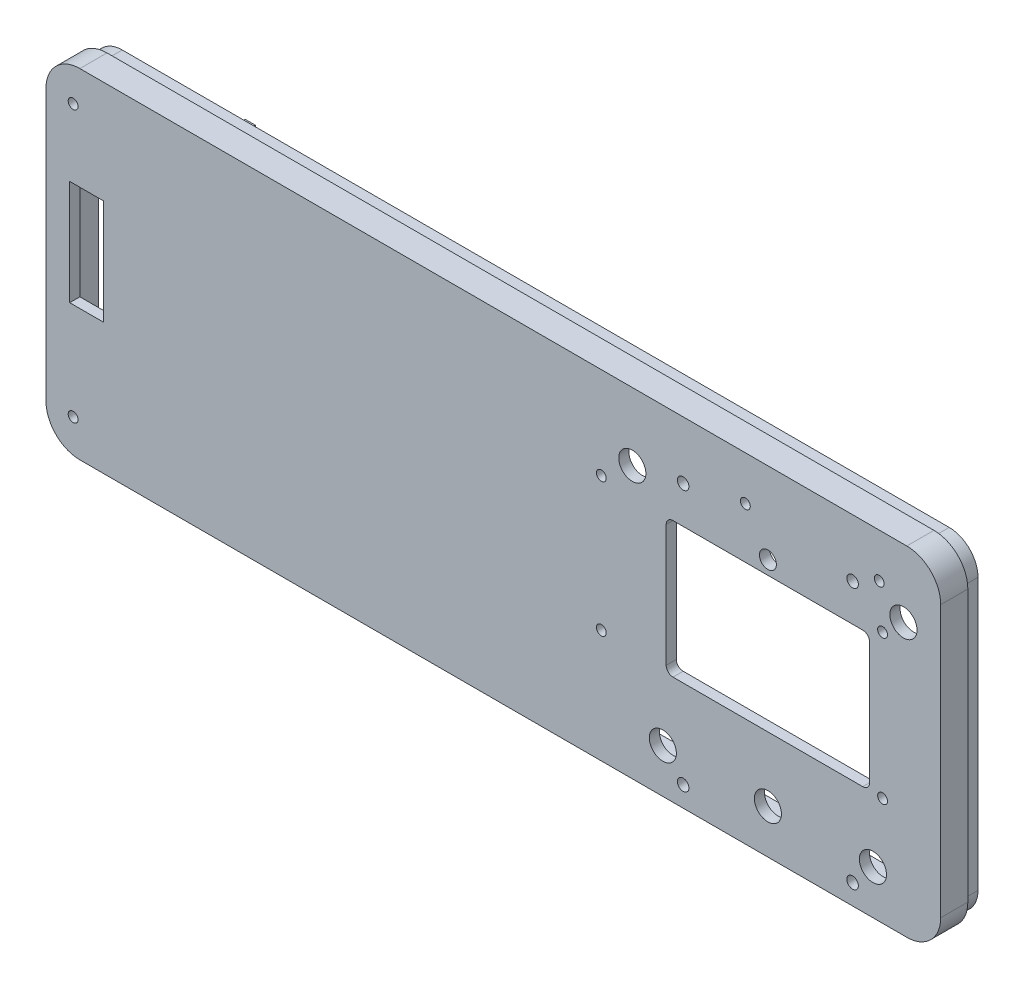
from build123d import *

# Parameters (mm, degrees)
BOX_EXTRUDE_DEPTH                = 12.5
SHELL1_T                         = -3
CUT_SWEEP_START                  = -12.5
CUT_SWEEP_DEPTH                  = 4.5
SKETCH2_W                        = 10
SKETCH2_H                        = 10
SQUARES_EXTRUDE_DEPTH            = 9.5
SKETCH11_W                       = 10
SKETCH11_H                       = 31
SKETCH11_W_2                     = 45
SKETCH11_H_2                     = 10
CUT_EXTRUDE2_DEPTH               = 214.65503369
SQUARES_M3_CLEARANCE_HOLES_D     = 2.5
SQUARES_M3_CLEARANCE_HOLES_DEPTH = 2
SQUARES_M3_CLEARANCE_HOLES_TIP   = 0.751075774
F_8_0MM_DOWEL_HOLE1_D            = 8
F_8_0MM_DOWEL_HOLE1_DEPTH        = 7.5
F_8_0MM_DOWEL_HOLE1_TIP          = 2.403442476
F_5_0MM_DOWEL_HOLE1_D            = 5
F_5_0MM_DOWEL_HOLE1_DEPTH        = 7.5
F_5_0MM_DOWEL_HOLE1_TIP          = 1.502151548
M3_CLEARANCE_HOLE3_D             = 3.4
M3_CLEARANCE_HOLE3_DEPTH         = 7.5
M3_CLEARANCE_HOLE3_TIP           = 1.021463052
M3_5X0_6_TAPPED_HOLE1_D          = 2.9
M3_5X0_6_TAPPED_HOLE2_D          = 2.9
M3_5X0_6_TAPPED_HOLE2_DEPTH      = 8.8
M3_5X0_6_TAPPED_HOLE2_TIP        = 0.871247898
SKETCH25_W                       = 3
SKETCH25_H                       = 31
BOSS_EXTRUDE1_DEPTH              = 38.75
F_2_5MM_DOWEL_HOLE1_D            = 2.5
F_2_5MM_DOWEL_HOLE1_DEPTH        = 10
F_2_5MM_DOWEL_HOLE1_TIP          = 0.751075774


# Read off the part's stored shape, not the designer's step: Cut-Sweep
with BuildPart() as part:
    # Sketch1 → Box-Extrude (new body)
    with BuildSketch(Plane.XY):
        with BuildLine():
            Line((-64.633571826, -98.481365252), (179.366428174, -98.481365252))
            ThreePointArc((179.366428174, -98.481365252), (186.437495986, -95.552433064), (189.366428174, -88.481365252))
            Line((189.366428174, -88.481365252), (189.366428174, -8.481365252))
            ThreePointArc((189.366428174, -8.481365252), (186.437495986, -1.41029744), (179.366428174, 1.518634748))
            Line((179.366428174, 1.518634748), (-64.633571826, 1.518634748))
            ThreePointArc((-64.633571826, 1.518634748), (-71.704639638, -1.41029744), (-74.633571826, -8.481365252))
            Line((-74.633571826, -8.481365252), (-74.633571826, -88.481365252))
            ThreePointArc((-74.633571826, -88.481365252), (-71.704639638, -95.552433064), (-64.633571826, -98.481365252))
        make_face()
    extrude(amount=-BOX_EXTRUDE_DEPTH)

    # Shell1
    shell1_openings = [part.faces().sort_by_distance(p)[0] for p in [
        (57.366428174, -48.481365252, -12.5),
    ]]
    offset(amount=SHELL1_T, openings=shell1_openings, kind=Kind.INTERSECTION)

    # Cut-Sweep outline → Cut-Sweep (cut)
    with BuildSketch(Plane.XY.offset(CUT_SWEEP_START)):
        with BuildLine():
            Line((189.366428174, -88.481365252), (189.366428174, -8.481365252))
            ThreePointArc((189.366428174, -8.481365252), (186.437495986, -1.41029744), (179.366428174, 1.518634748))
            Line((179.366428174, 1.518634748), (-64.633571826, 1.518634748))
            ThreePointArc((-64.633571826, 1.518634748), (-71.704639638, -1.41029744), (-74.633571826, -8.481365252))
            Line((-74.633571826, -8.481365252), (-74.633571826, -88.481365252))
            ThreePointArc((-74.633571826, -88.481365252), (-71.704639638, -95.552433064), (-64.633571826, -98.481365252))
            Line((-64.633571826, -98.481365252), (179.366428174, -98.481365252))
            ThreePointArc((179.366428174, -98.481365252), (186.437495986, -95.552433064), (189.366428174, -88.481365252))
        make_face()
        with BuildLine():
            Line((179.366428174, -96.981365252), (-64.633571826, -96.981365252))
            ThreePointArc((-64.633571826, -96.981365252), (-70.643979466, -94.491772892), (-73.133571826, -88.481365252))
            Line((-73.133571826, -88.481365252), (-73.133571826, -8.481365252))
            ThreePointArc((-73.133571826, -8.481365252), (-70.643979466, -2.470957612), (-64.633571826, 0.018634748))
            Line((-64.633571826, 0.018634748), (179.366428174, 0.018634748))
            ThreePointArc((179.366428174, 0.018634748), (185.376835814, -2.470957612), (187.866428174, -8.481365252))
            Line((187.866428174, -8.481365252), (187.866428174, -88.481365252))
            ThreePointArc((187.866428174, -88.481365252), (185.376835814, -94.491772892), (179.366428174, -96.981365252))
        make_face(mode=Mode.SUBTRACT)
    extrude(amount=CUT_SWEEP_DEPTH, mode=Mode.SUBTRACT)

    # Sketch2 → Squares-Extrude (add)
    with BuildSketch(Plane.XY.offset(-3)):
        with Locations((41.816428174, -6.481365252)):
            Rectangle(SKETCH2_W, SKETCH2_H)
        with Locations((181.366428174, -65.481365252)):
            Rectangle(SKETCH2_W, SKETCH2_H)
        with Locations((41.366428174, -90.481365252)):
            Rectangle(SKETCH2_W, SKETCH2_H)
        with Locations((181.366428174, -31.481365252)):
            Rectangle(SKETCH2_W, SKETCH2_H)
    extrude(amount=-SQUARES_EXTRUDE_DEPTH)

    # Sketch11 → Cut-Extrude2 (cut, through all)
    with BuildSketch(Plane(origin=(0, 0, -3), x_dir=(-1, 0, 0), z_dir=(0, 0, -1))):
        with BuildLine():
            Line((-166.366428174, -66.481365252), (-110.366428174, -66.481365252))
            ThreePointArc((-110.366428174, -66.481365252), (-108.952214612, -65.895578814), (-108.366428174, -64.481365252))
            Line((-108.366428174, -64.481365252), (-108.366428174, -28.481365252))
            ThreePointArc((-108.366428174, -28.481365252), (-108.952214612, -27.067151689), (-110.366428174, -26.481365252))
            Line((-110.366428174, -26.481365252), (-166.366428174, -26.481365252))
            ThreePointArc((-166.366428174, -26.481365252), (-167.780641736, -27.067151689), (-168.366428174, -28.481365252))
            Line((-168.366428174, -28.481365252), (-168.366428174, -64.481365252))
            ThreePointArc((-168.366428174, -64.481365252), (-167.780641736, -65.895578814), (-166.366428174, -66.481365252))
        make_face()
        with Locations((62.633571826, -44.311365252)):
            Rectangle(SKETCH11_W, SKETCH11_H)
        with Locations((-152.769428174, 113.518634748)):
            Rectangle(SKETCH11_W_2, SKETCH11_H_2)
    extrude(amount=-CUT_EXTRUDE2_DEPTH, mode=Mode.SUBTRACT)

    # Squares M3 Clearance Holes
    with Locations(Plane(origin=(0, 0, -12.5), x_dir=(1, 0, 0), z_dir=(0, 0, -1))):
        with Locations((41.816428174, 6.481365252), (181.366428174, 31.481365252), (181.366428174, 65.481365252), (41.366428174, 90.481365252)):
            Hole(SQUARES_M3_CLEARANCE_HOLES_D / 2, depth=SQUARES_M3_CLEARANCE_HOLES_DEPTH)
            with Locations((0, 0, -(SQUARES_M3_CLEARANCE_HOLES_DEPTH + SQUARES_M3_CLEARANCE_HOLES_TIP / 2))):  # 118° drill point
                Cone(0, SQUARES_M3_CLEARANCE_HOLES_D / 2, SQUARES_M3_CLEARANCE_HOLES_TIP, mode=Mode.SUBTRACT)

    # Ø8.0mm Dowel Hole1
    with Locations(Plane(origin=(169.366428174, -85.481365252, -3), x_dir=(-1, 0, 0), z_dir=(0, 0, -1))):
        with Locations((0, 0), (31, 0), (62, 0), (71, 67), (-9, 67)):
            Hole(F_8_0MM_DOWEL_HOLE1_D / 2, depth=F_8_0MM_DOWEL_HOLE1_DEPTH)
            with Locations((0, 0, -(F_8_0MM_DOWEL_HOLE1_DEPTH + F_8_0MM_DOWEL_HOLE1_TIP / 2))):  # 118° drill point
                Cone(0, F_8_0MM_DOWEL_HOLE1_D / 2, F_8_0MM_DOWEL_HOLE1_TIP, mode=Mode.SUBTRACT)

    # Ø5.0mm Dowel Hole1
    with Locations(Plane(origin=(0, 0, -3), x_dir=(-1, 0, 0), z_dir=(0, 0, -1))):
        with Locations((-138.366428174, -22.481365252)):
            Hole(F_5_0MM_DOWEL_HOLE1_D / 2, depth=F_5_0MM_DOWEL_HOLE1_DEPTH)
            with Locations((0, 0, -(F_5_0MM_DOWEL_HOLE1_DEPTH + F_5_0MM_DOWEL_HOLE1_TIP / 2))):  # 118° drill point
                Cone(0, F_5_0MM_DOWEL_HOLE1_D / 2, F_5_0MM_DOWEL_HOLE1_TIP, mode=Mode.SUBTRACT)

    # M3 Clearance Hole3
    with Locations(Plane(origin=(0, 0, -3), x_dir=(-1, 0, 0), z_dir=(0, 0, -1))):
        with Locations((-163.366428174, -15.481365252), (-113.366428174, -15.481365252), (-163.366428174, -92.481365252), (-113.366428174, -92.481365252)):
            Hole(M3_CLEARANCE_HOLE3_D / 2, depth=M3_CLEARANCE_HOLE3_DEPTH)
            with Locations((0, 0, -(M3_CLEARANCE_HOLE3_DEPTH + M3_CLEARANCE_HOLE3_TIP / 2))):  # 118° drill point
                Cone(0, M3_CLEARANCE_HOLE3_D / 2, M3_CLEARANCE_HOLE3_TIP, mode=Mode.SUBTRACT)

    # M3.5x0.6 Tapped Hole1 (through all)
    with Locations(Plane(origin=(0, 0, -3), x_dir=(-1, 0, 0), z_dir=(0, 0, -1))):
        with Locations((-172.205915164, -24.061365252), (-172.205915164, -66.561365252), (-89.226428174, -25.561365252), (-89.226428174, -65.061365252), (-171.219428174, -11.481365252), (-131.719428174, -11.481365252)):
            Hole(M3_5X0_6_TAPPED_HOLE1_D / 2)

    # M3.5x0.6 Tapped Hole2
    with Locations(Plane.XY):
        with Locations((-66.633571826, -8.481365252), (-66.633571826, -88.481365252)):
            Hole(M3_5X0_6_TAPPED_HOLE2_D / 2, depth=M3_5X0_6_TAPPED_HOLE2_DEPTH)
            with Locations((0, 0, -(M3_5X0_6_TAPPED_HOLE2_DEPTH + M3_5X0_6_TAPPED_HOLE2_TIP / 2))):  # 118° drill point
                Cone(0, M3_5X0_6_TAPPED_HOLE2_D / 2, M3_5X0_6_TAPPED_HOLE2_TIP, mode=Mode.SUBTRACT)

    # Sketch25 → Boss-Extrude1 (add)
    with BuildSketch(Plane(origin=(0, 0, -3), x_dir=(-1, 0, 0), z_dir=(0, 0, -1))):
        with Locations((56.133571826, -44.311365252)):
            Rectangle(SKETCH25_W, SKETCH25_H)
    extrude(amount=BOSS_EXTRUDE1_DEPTH)

    # Ø2.5mm Dowel Hole1
    with Locations(Plane(origin=(-54.633571826, 0, 0), x_dir=(0, 0, -1), z_dir=(1, 0, 0))):
        with Locations((37.25, -32.811365252), (37.25, -55.811365252), (14.25, -32.811365252), (14.25, -55.811365252)):
            Hole(F_2_5MM_DOWEL_HOLE1_D / 2, depth=F_2_5MM_DOWEL_HOLE1_DEPTH)
            with Locations((0, 0, -(F_2_5MM_DOWEL_HOLE1_DEPTH + F_2_5MM_DOWEL_HOLE1_TIP / 2))):  # 118° drill point
                Cone(0, F_2_5MM_DOWEL_HOLE1_D / 2, F_2_5MM_DOWEL_HOLE1_TIP, mode=Mode.SUBTRACT)


solid = part.part
